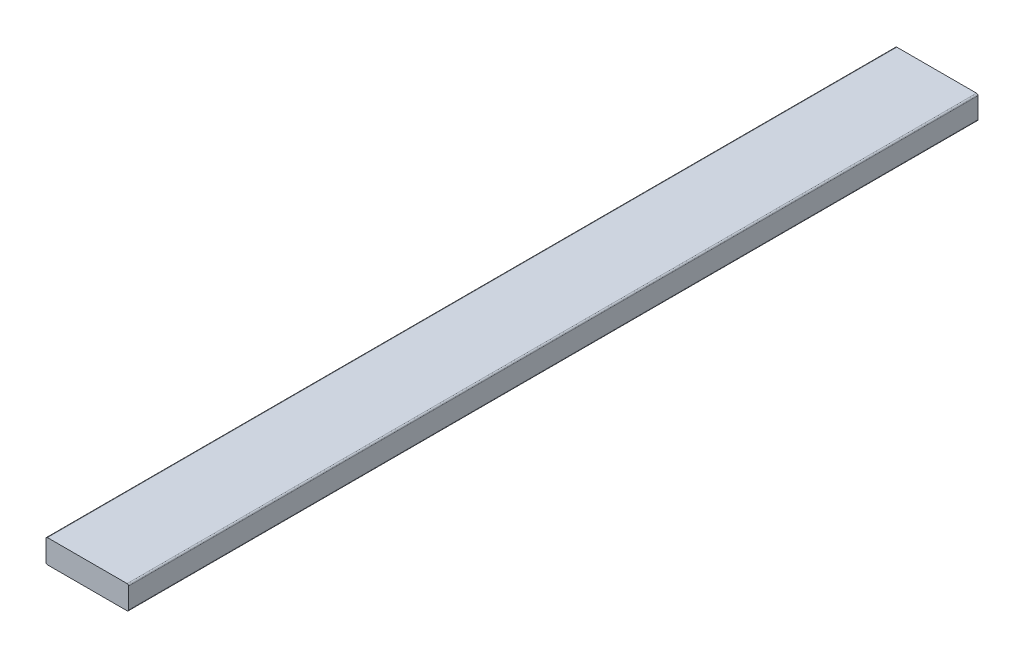
from build123d import *

# Parameters (mm, degrees)
SKETCH1_W           = 88.9
SKETCH1_H           = 25.4
BOSS_EXTRUDE1_DEPTH = 914.4
FILLET1_R           = 1.5875


with BuildPart() as part:
    # Sketch1 → Boss-Extrude1 (new body)
    with BuildSketch(Plane.XY):
        Rectangle(SKETCH1_W, SKETCH1_H)
    extrude(amount=BOSS_EXTRUDE1_DEPTH)

    # Fillet1
    fillet1_edges = [part.edges().sort_by_distance(p)[0] for p in [
        (-44.45, -12.7, 457.2),
        (44.45, -12.7, 457.2),
        (-44.45, 12.7, 457.2),
        (44.45, 12.7, 457.2),
    ]]
    fillet(fillet1_edges, radius=FILLET1_R)


solid = part.part
